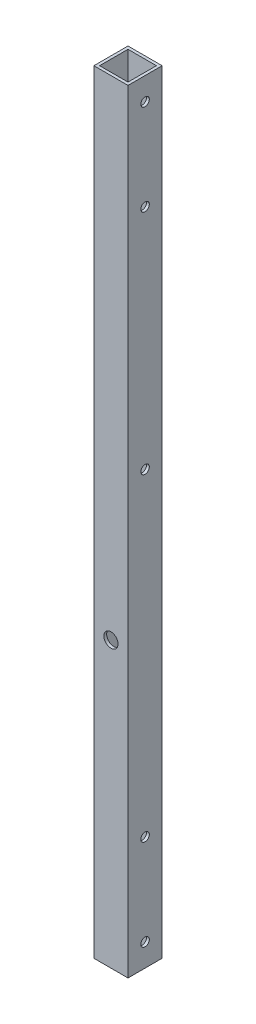
from build123d import *

# Parameters (mm, degrees)
SKETCH1_W               = 19.05
SKETCH1_H               = 19.05
SKETCH1_W_2             = 15.875
SKETCH1_H_2             = 15.875
BOSS_EXTRUDE1_DEPTH     = 431.8
CUT_EXTRUDE1_REACH      = 434.325
SKETCH2_R               = 3.96875
CUT_EXTRUDE2_DEPTH      = 433.0100592
CUT_EXTRUDE2_DEPTH_BACK = 433.0100592
SKETCH3_R               = 2.38125


with BuildPart() as part:
    # Sketch1 → Boss-Extrude1 (new body)
    with BuildSketch(Plane(origin=(0, 0, 0), x_dir=(1, 0, 0), z_dir=(0, 1, 0))):
        Rectangle(SKETCH1_W, SKETCH1_H)
        Rectangle(SKETCH1_W_2, SKETCH1_H_2, mode=Mode.SUBTRACT)
    extrude(amount=BOSS_EXTRUDE1_DEPTH)

    # Sketch2 → Cut-Extrude1 (cut, up to next)
    with BuildSketch(Plane.XY.offset(9.525), mode=Mode.PRIVATE) as cut_extrude1_sk1:
        with Locations((0, 158.75)):
            Circle(SKETCH2_R)
    cut_extrude1_tool1 = extrude(cut_extrude1_sk1.sketch, amount=-CUT_EXTRUDE1_REACH, mode=Mode.PRIVATE) & part.part
    add(cut_extrude1_tool1.solids().sort_by_distance((0, 158.75, 9.525))[0], mode=Mode.SUBTRACT)

    # Sketch3 → Cut-Extrude2 (cut, two sides: drawn at the far end of the back side and taken through both)
    with BuildSketch(Plane(origin=(0, 0, 0), x_dir=(0, 0, -1), z_dir=(1, 0, 0)).offset(-CUT_EXTRUDE2_DEPTH_BACK)):
        with Locations((0, 12.7)):
            Circle(SKETCH3_R)
        with Locations((0, 63.5)):
            Circle(SKETCH3_R)
        with Locations((0, 241.3)):
            Circle(SKETCH3_R)
        with Locations((0, 368.3)):
            Circle(SKETCH3_R)
        with Locations((0, 419.1)):
            Circle(SKETCH3_R)
    extrude(amount=CUT_EXTRUDE2_DEPTH + CUT_EXTRUDE2_DEPTH_BACK, mode=Mode.SUBTRACT)


solid = part.part
